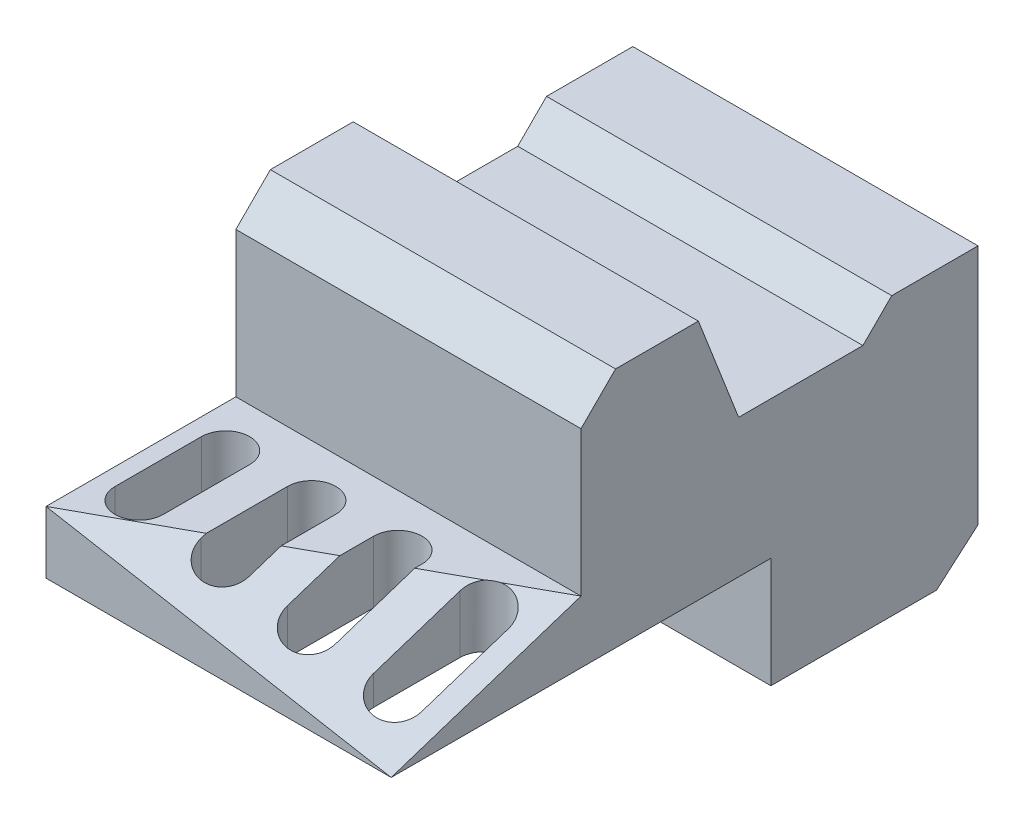
from build123d import *

# Parameters (mm, degrees)
RESSALTO_EXTRUS_O1_DEPTH = 100
CORTE_EXTRUS_O1_DEPTH    = 204.970201133
CORTE_EXTRUS_O4_DEPTH    = 87


with BuildPart() as part:
    # Esboço3 → Ressalto-extrusão1 (new body)
    with BuildSketch(Plane(origin=(0, 0, 0), x_dir=(0, 0, -1), z_dir=(1, 0, 0))):
        Polygon((0, 0), (0, -70), (-12, -80.38), (-60, -80.38), (-60, -48.378489886), (-170, -48.378489886), (-170, -30.378489886), (-115, -30.378489886), (-115, 11.621510114), (-105.001510114, 21.62), (-81.001510114, 21.62), (-69.343860018, -8.343860018), (-33.343860018, -8.343860018), (-25, 0), align=None)
    extrude(amount=RESSALTO_EXTRUS_O1_DEPTH)

    # Esboço5 → Corte-extrusão1 (cut, through all)
    with BuildSketch(Plane(origin=(0, -30.378489886, 0), x_dir=(1, 0, 0), z_dir=(0, 1, 0))):
        with BuildLine():
            Line((5, -155.02), (5, -129.98))
            ThreePointArc((5, -129.98), (12, -122.98), (19, -129.98))
            Line((19, -129.98), (19, -155.02))
            ThreePointArc((19, -155.02), (12, -162.02), (5, -155.02))
        make_face()
        with BuildLine():
            Line((29.96, -155.02), (29.96, -129.98))
            ThreePointArc((29.96, -129.98), (36.96, -122.98), (43.96, -129.98))
            Line((43.96, -129.98), (43.96, -155.02))
            ThreePointArc((43.96, -155.02), (36.96, -162.02), (29.96, -155.02))
        make_face()
        with BuildLine():
            Line((54.92, -155.02), (54.92, -129.98))
            ThreePointArc((54.92, -129.98), (61.92, -122.98), (68.92, -129.98))
            Line((68.92, -129.98), (68.92, -155.02))
            ThreePointArc((68.92, -155.02), (61.92, -162.02), (54.92, -155.02))
        make_face()
        with BuildLine():
            Line((79.88, -155.02), (79.88, -129.98))
            ThreePointArc((79.88, -129.98), (86.88, -122.98), (93.88, -129.98))
            Line((93.88, -129.98), (93.88, -155.02))
            ThreePointArc((93.88, -155.02), (86.88, -162.02), (79.88, -155.02))
        make_face()
    extrude(amount=-CORTE_EXTRUS_O1_DEPTH, mode=Mode.SUBTRACT)

    # Esboço6 → Corte-extrusão4 (cut)
    with BuildSketch(Plane(origin=(3.989809214, 22.165606742, 7.25419857), x_dir=(0.9856808114809098, -0.16025774913447463, -0.05244799062582808), z_dir=(0.16862187840946133, 0.9367882133858959, 0.30658523347174793))):
        Polygon((-4.047769995, -171.016408889), (97.404950637, -176.615111976), (97.404950637, -118.744566791), align=None)
    extrude(amount=CORTE_EXTRUS_O4_DEPTH, mode=Mode.SUBTRACT)


solid = part.part
